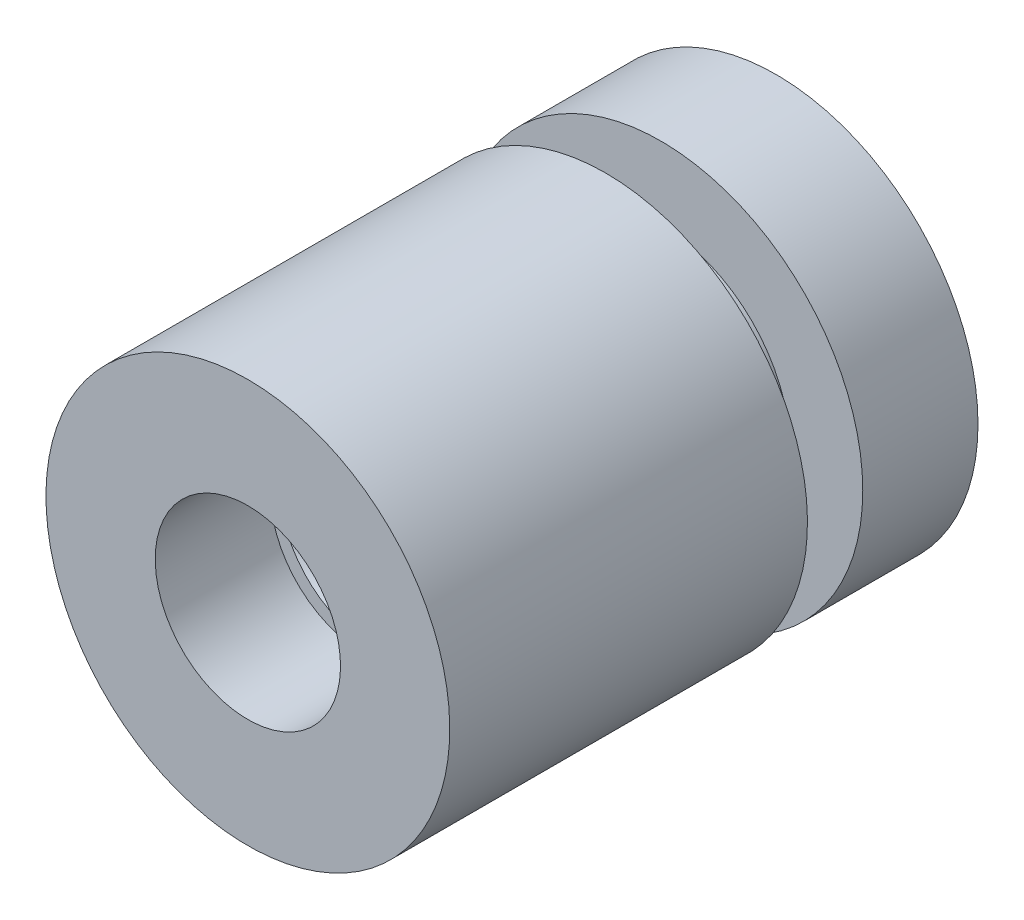
from build123d import *


# Read off the part's stored shape, not the designer's step: #10-32 Tapped Hole1
with BuildPart() as part:
    # Sketch1 → Revolve1 (revolve)
    with BuildSketch(Plane(origin=(0, 0, 0), x_dir=(0, 0, -1), z_dir=(1, 0, 0)), mode=Mode.PRIVATE) as revolve1_sk:
        with BuildLine():
            Line((0, 5.5626), (-3.175, 5.5626))
            Line((-3.175, 5.5626), (-3.175, 3.556))
            Line((-3.175, 3.556), (-11.1252, 3.556))
            Line((-11.1252, 3.556), (-11.1252, 0))
            Line((-11.1252, 0), (-1.016, 0))
            ThreePointArc((-1.016, 0), (-0.821524687, 2.838564783), (0, 5.5626))
        make_face()
    revolve(revolve1_sk.sketch.rotate(Axis((0, 0, -3.095973099), (0, 0, -1)), 90), axis=Axis((0, 0, -3.095973099), (0, 0, -1)))

    # #10-32 Tapped Hole1 outline → #10-32 Tapped Hole1 (revolve, cut)
    with BuildSketch(Plane.XZ):
        Polygon((0, 0.872385993), (2.54, 0.872385993), (2.54, 1.016), (2.0193, 1.5367), (2.0193, 10.6045), (2.54, 11.1252), (0, 11.1252), align=None)
    revolve(axis=Axis((0, 0, 0), (0, 0, 1)), mode=Mode.SUBTRACT)


with BuildPart() as body_2:
    # Sketch4 → Revolve2 (revolve)
    with BuildSketch(Plane(origin=(0, 0, 0), x_dir=(0, 0, -1), z_dir=(1, 0, 0))):
        Polygon((-4.699, 3.6195), (-4.699, 5.5626), (-14.5542, 5.5626), (-14.5542, 2.5527), (-11.3792, 2.5527), (-11.3792, 3.6195), align=None)
    revolve(axis=Axis((0, 0, 18.738609771), (0, 0, 1)))


solid = Compound([part.part, body_2.part])
